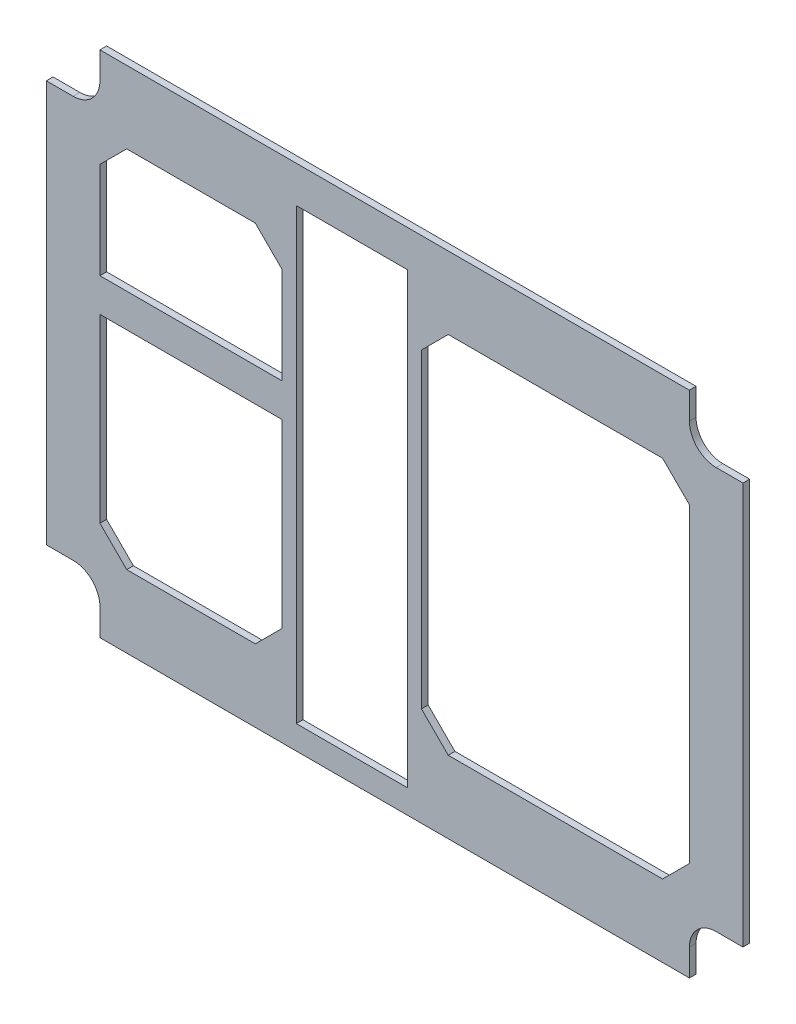
from build123d import *

# Parameters (mm, degrees)
SKETCH1_W           = 20.32
SKETCH1_H           = 100.33
BOSS_EXTRUDE1_DEPTH = 1.5875
SKETCH2_W           = 26.32
SKETCH2_H           = 106.33
CUT_EXTRUDE1_DEPTH  = 205.491937876


with BuildPart() as part:
    # Sketch1 → Boss-Extrude1 (new body)
    with BuildSketch(Plane.XY):
        with BuildLine():
            Line((0, -12.7), (-6.35, -12.7))
            ThreePointArc((-6.35, -12.7), (-10.840128061, -10.840128061), (-12.7, -6.35))
            Line((-12.7, -6.35), (-12.7, 0))
            Line((-12.7, 0), (-152.4, 0))
            Line((-152.4, 0), (-152.4, -6.35))
            ThreePointArc((-152.4, -6.35), (-154.259871939, -10.840128061), (-158.75, -12.7))
            Line((-158.75, -12.7), (-165.1, -12.7))
            Line((-165.1, -12.7), (-165.1, -107.95))
            Line((-165.1, -107.95), (-158.75, -107.95))
            ThreePointArc((-158.75, -107.95), (-154.259871939, -109.809871939), (-152.4, -114.3))
            Line((-152.4, -114.3), (-152.4, -120.65))
            Line((-152.4, -120.65), (-12.7, -120.65))
            Line((-12.7, -120.65), (-12.7, -114.3))
            ThreePointArc((-12.7, -114.3), (-10.840128061, -109.809871939), (-6.35, -107.95))
            Line((-6.35, -107.95), (0, -107.95))
            Line((0, -107.95), (0, -12.7))
        make_face()
        with Locations((-92.71, -61.849)):
            Rectangle(SKETCH1_W, SKETCH1_H, mode=Mode.SUBTRACT)
        Polygon((-19.05, -17.145), (-69.85, -17.145), (-76.2, -23.495), (-76.2, -97.155), (-69.85, -103.505), (-19.05, -103.505), (-12.7, -97.155), (-12.7, -23.495), align=None, mode=Mode.SUBTRACT)
        Polygon((-152.4, -23.495), (-152.4, -46.355), (-109.22, -46.355), (-109.22, -23.495), (-115.57, -17.145), (-146.05, -17.145), align=None, mode=Mode.SUBTRACT)
        Polygon((-109.22, -97.155), (-109.22, -54.2925), (-152.4, -54.2925), (-152.4, -97.155), (-146.05, -103.505), (-115.57, -103.505), align=None, mode=Mode.SUBTRACT)
    extrude(amount=BOSS_EXTRUDE1_DEPTH)

    # Sketch2 → Cut-Extrude1 (cut, through all)
    with BuildSketch(Plane(origin=(0, 0, 0), x_dir=(-1, 0, 0), z_dir=(0, 0, -1))):
        with Locations((92.71, -61.849)):
            Rectangle(SKETCH2_W, SKETCH2_H)
    extrude(amount=-CUT_EXTRUDE1_DEPTH, mode=Mode.SUBTRACT)


solid = part.part
